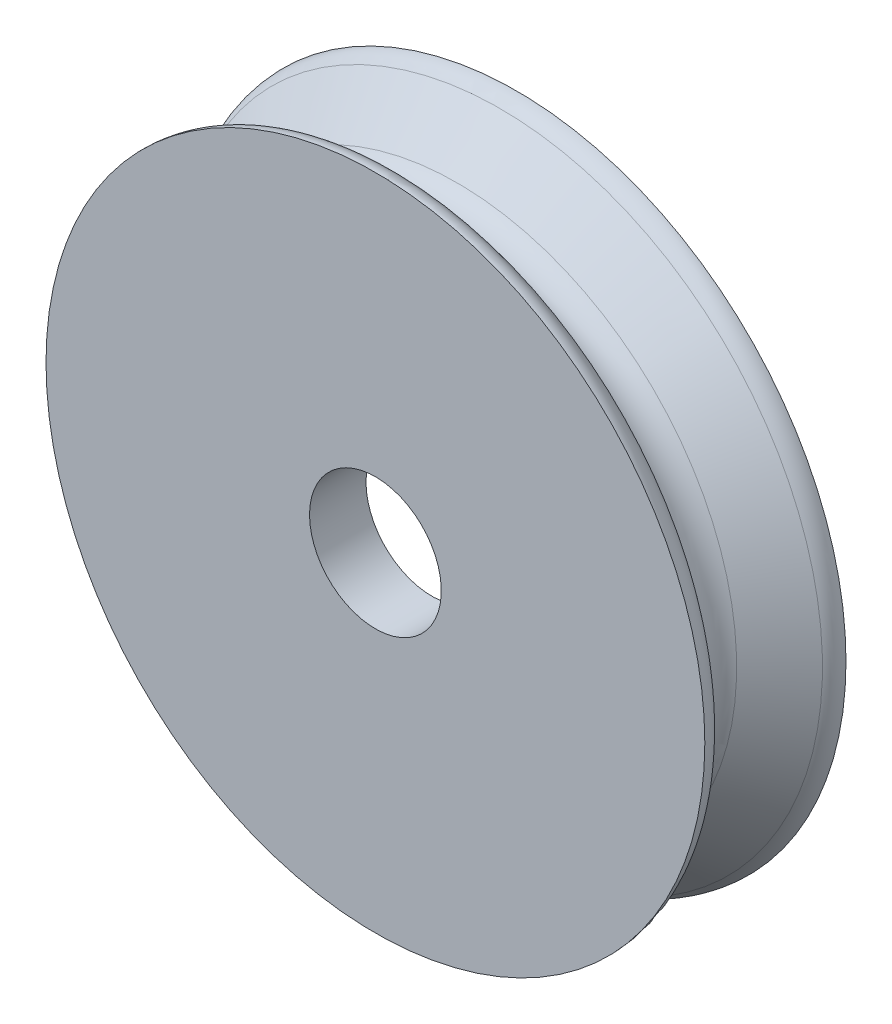
from build123d import *


with BuildPart() as part:
    # Sketch1 → Revolve1 (revolve)
    with BuildSketch(Plane(origin=(0, 0, 0), x_dir=(0, 0, -1), z_dir=(1, 0, 0))):
        with BuildLine():
            Line((-3.6, 2.8), (-6, 2.8))
            Line((-6, 2.8), (-6, 14))
            ThreePointArc((-6, 14), (-5.391238571, 13.79335334), (-5.034074174, 13.258819045))
            Line((-5.034074174, 13.258819045), (-4.830808354, 12.50022068))
            ThreePointArc((-4.830808354, 12.50022068), (-3.85853653, 11.527948856), (-2.530388519, 11.883825043))
            Line((-2.530388519, 11.883825043), (-0.707106781, 13.707106781))
            ThreePointArc((-0.707106781, 13.707106781), (-0.382683432, 13.923879533), (0, 14))
            Line((0, 14), (0, 12.151471863))
            Line((0, 12.151471863), (-3.6, 8.551471863))
            Line((-3.6, 8.551471863), (-3.6, 2.8))
        make_face()
    revolve(axis=Axis((0, 0, 0), (0, 0, 1)))


solid = part.part
